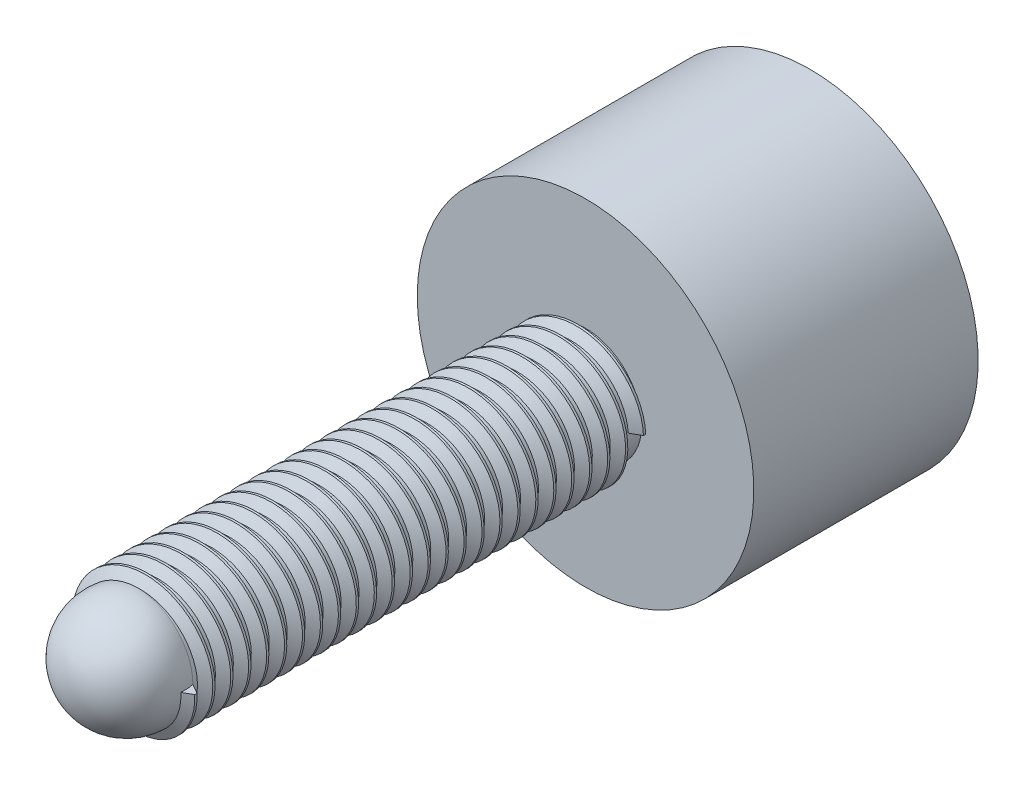
from build123d import *

# Parameters (mm, degrees)
SKETCH1_R           = 2.5
BOSS_EXTRUDE1_DEPTH = 20
DOME1_FACE_RADIUS   = 2.5
DOME1_HEIGHT        = 3
THREAD1_PITCH       = 0.8
SKETCH5_R           = 7.5
BOSS_EXTRUDE2_DEPTH = 10
SKETCH6_W           = 4
SKETCH6_H           = 6
CUT_EXTRUDE1_DEPTH  = 8


with BuildPart() as part:
    # Sketch1 → Boss-Extrude1 (new body)
    with BuildSketch(Plane.XY):
        Circle(SKETCH1_R)
    extrude(amount=BOSS_EXTRUDE1_DEPTH)

    # Dome1: a dome of height H over a round flat face of radius A is a cap of a sphere of radius (A * A + H * H) / (2 * H)
    dome1_r = (DOME1_FACE_RADIUS * DOME1_FACE_RADIUS + DOME1_HEIGHT * DOME1_HEIGHT) / (2 * DOME1_HEIGHT)
    dome1_base = Plane((0, 0, 20), z_dir=(0, 0, 1))
    with Locations(dome1_base.offset(DOME1_HEIGHT - dome1_r)):
        dome1_ball = Sphere(dome1_r, mode=Mode.PRIVATE)
    add(split(dome1_ball, bisect_by=dome1_base, keep=Keep.TOP, mode=Mode.PRIVATE))

    # Thread1: the profile of Thread Profile1 profile screwed along a right-hand helix of 25 turns, 8 arcs to a turn; built about Z, then put on its axis
    thread1_z = Axis((0, 0, 0), (0, 0, 1))
    thread1_corners = [(2.4997, 0, -0.000173205), (2.9330127, 0, 0.249999999), (2.9330127, 0, 0.349999999), (2.4997, 0, 0.600173203)]
    with BuildLine(mode=Mode.PRIVATE) as thread1_profile:
        Line(thread1_corners[0], thread1_corners[1])
        Line(thread1_corners[1], thread1_corners[2])
        Line(thread1_corners[2], thread1_corners[3])
        Line(thread1_corners[3], thread1_corners[0])
    thread1_cap = Face(thread1_profile.wire())
    thread1_turn_angles = [0, 22.5, 45, 67.5, 90, 112.5, 135, 157.5, 180, 202.5, 225, 247.5, 270, 292.5, 315, 337.5, 360]
    thread1_turn_weights = [1, 0.9238795325112867, 1, 0.9238795325112867, 1, 0.9238795325112867, 1, 0.9238795325112867, 1, 0.9238795325112867, 1, 0.9238795325112867, 1, 0.9238795325112867, 1, 0.9238795325112867, 1]
    thread1_turn_rails = [Edge.make_bspline([Vector(p[0], p[1], 0).rotate(thread1_z, thread1_turn_angles[k]) / thread1_turn_weights[k] + Vector(0, 0, p[2] + THREAD1_PITCH * thread1_turn_angles[k] / 360) for k in range(17)], [0, 0, 0, 1, 1, 2, 2, 3, 3, 4, 4, 5, 5, 6, 6, 7, 7, 8, 8, 8], 2, thread1_turn_weights) for p in thread1_corners]
    thread1_turn_sides = [Face.make_surface_from_curves(thread1_turn_rails[p[0]], thread1_turn_rails[p[1]]) for p in [(0, 1), (1, 2), (2, 3), (3, 0)]]
    thread1 = Plane(origin=(0, 0, 0), x_dir=(1, 0, 0), z_dir=(0, 0, 1)) * Solid(Shell([*[p.moved(Location((0, 0, THREAD1_PITCH * i))) for i in range(25) for p in thread1_turn_sides], thread1_cap, thread1_cap.rotate(thread1_z, 9000).moved(Location((0, 0, THREAD1_PITCH * 9000 / 360)))]))
    add(thread1)

    # Sketch5 → Boss-Extrude2 (add)
    with BuildSketch(Plane(origin=(0, 0, 0), x_dir=(-1, 0, 0), z_dir=(0, 0, -1))):
        Circle(SKETCH5_R)
    extrude(amount=BOSS_EXTRUDE2_DEPTH)

    # Sketch6 → Cut-Extrude1 (cut)
    with BuildSketch(Plane(origin=(0, 0, -10), x_dir=(-1, 0, 0), z_dir=(0, 0, -1))):
        Rectangle(SKETCH6_W, SKETCH6_H)
    extrude(amount=-CUT_EXTRUDE1_DEPTH, mode=Mode.SUBTRACT)


solid = part.part
